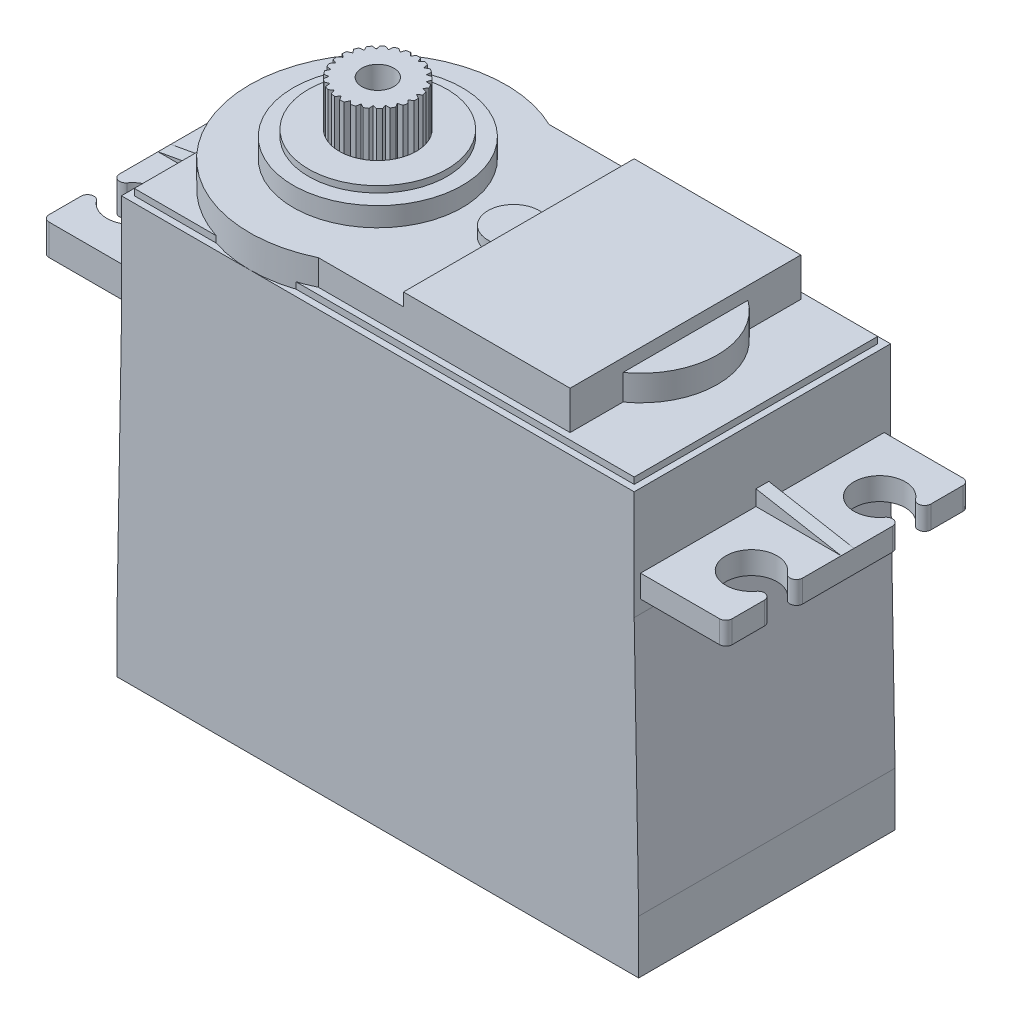
from build123d import *

# Parameters (mm, degrees)
BODY_1_DEPTH                                     = 10
SKETCH2_W                                        = 39
SKETCH2_H                                        = 19
BOSS_EXTRUDE3_DEPTH                              = 0.5
BOSS_EXTRUDE5_DEPTH                              = 0.5
BOSS_EXTRUDE6_START                              = 2
BOSS_EXTRUDE6_DEPTH                              = 2
SKETCH11_W                                       = 13
SKETCH11_H                                       = 18
BOSS_EXTRUDE7_DEPTH                              = 1
BOSS_EXTRUDE8_DEPTH                              = 0.8
SKETCH13_R                                       = 6.6
BOSS_EXTRUDE9_DEPTH                              = 1.5
SKETCH14_R                                       = 5.4
BOSS_EXTRUDE10_DEPTH                             = 0.5
SKETCH17_R                                       = 3
CUT_EXTRUDE1_DEPTH                               = 12
CHAMFER2_SIZE                                    = 2.82
CBORE_FOR_M2_PAN_HEAD_MACHINE_SCREW1_D           = 2.4
CBORE_FOR_M2_PAN_HEAD_MACHINE_SCREW1_DEPTH       = 8
CBORE_FOR_M2_PAN_HEAD_MACHINE_SCREW1_CBORE_D     = 5
CBORE_FOR_M2_PAN_HEAD_MACHINE_SCREW1_CBORE_DEPTH = 1.6
CBORE_FOR_M2_PAN_HEAD_MACHINE_SCREW1_TIP         = 0.721032743
SKETCH21_R                                       = 3
BOSS_EXTRUDE11_DEPTH                             = 10.5
BOSS_EXTRUDE16_DEPTH                             = 5
SKETCH23_W                                       = 19
SKETCH23_H                                       = 1.753963838
BOSS_EXTRUDE17_DEPTH                             = 6.65
FILLET1_R                                        = 0.5
CUT_EXTRUDE2_DEPTH                               = 7
SKETCH26_W                                       = 1
SKETCH26_H                                       = 1.2
BOSS_EXTRUDE18_DEPTH                             = 6.65
CUT_EXTRUDE3_DEPTH                               = 6.65
BOSS_EXTRUDE19_DEPTH                             = 6.65
CUT_EXTRUDE4_DEPTH                               = 6.65
CUT_EXTRUDE6_DEPTH                               = 6.65
FILLET2_R                                        = 0.5
SKETCH34_R                                       = 1.25
CUT_EXTRUDE7_DEPTH                               = 8


with BuildPart() as part:
    # Sketch1 → Body 1 (new, symmetric)
    with BuildSketch(Plane.XY):
        Polygon((0, 6.994041123), (0, 0), (40.698202597, 0), (40.698202597, 6.994041123), (40.349101299, 26.994041123), (40.349101299, 35.494041123), (0.349101299, 35.494041123), (0.349101299, 26.994041123), align=None)
    extrude(amount=BODY_1_DEPTH, both=True)

    # Sketch2 → Boss-Extrude3 (add)
    with BuildSketch(Plane(origin=(0, 35.494041123, 0), x_dir=(1, 0, 0), z_dir=(0, 1, 0))):
        with Locations((20.349101299, 0)):
            Rectangle(SKETCH2_W, SKETCH2_H)
    extrude(amount=BOSS_EXTRUDE3_DEPTH)

    # Sketch3 → Boss-Extrude5 (add)
    with BuildSketch(Plane(origin=(0, 35.994041123, 0), x_dir=(1, 0, 0), z_dir=(0, 1, 0))):
        with BuildLine():
            ThreePointArc((0.849101299, 3.122498999), (0.349101299, 0), (0.849101299, -3.122498999))
            Line((0.849101299, -3.122498999), (0.849101299, 3.122498999))
        make_face()
        with BuildLine():
            ThreePointArc((13.471600298, 9.5), (10.349101299, 10), (7.226602299, 9.5))
            Line((7.226602299, 9.5), (13.471600298, 9.5))
        make_face()
        with BuildLine():
            Line((13.471600298, -9.5), (7.226602299, -9.5))
            ThreePointArc((7.226602299, -9.5), (10.349101299, -10), (13.471600298, -9.5))
        make_face()
    extrude(amount=-BOSS_EXTRUDE5_DEPTH)

    # Sketch8 → Boss-Extrude6 (add)
    with BuildSketch(Plane(origin=(0, 35.994041123, 0), x_dir=(1, 0, 0), z_dir=(0, 1, 0)).offset(BOSS_EXTRUDE6_START)):
        with BuildLine():
            Line((14.708000242, -9), (34.349101299, -9))
            Line((34.349101299, -9), (34.349101299, -4.873397172))
            ThreePointArc((34.349101299, -4.873397172), (36.849101299, 0), (34.349101299, 4.873397172))
            Line((34.349101299, 4.873397172), (34.349101299, 9))
            Line((34.349101299, 9), (14.708000242, 9))
            ThreePointArc((14.708000242, 9), (5.038215753, 8.473163206), (0.349101299, 0))
            ThreePointArc((0.349101299, 0), (5.038215753, -8.473163206), (14.708000242, -9))
        make_face()
    extrude(amount=-BOSS_EXTRUDE6_DEPTH)

    # Sketch11 → Boss-Extrude7 (add)
    with BuildSketch(Plane(origin=(0, 37.994041123, 0), x_dir=(1, 0, 0), z_dir=(0, 1, 0))):
        with Locations((27.849101299, 0)):
            Rectangle(SKETCH11_W, SKETCH11_H)
    extrude(amount=BOSS_EXTRUDE7_DEPTH)

    # Sketch12 → Boss-Extrude8 (add)
    with BuildSketch(Plane(origin=(0, 37.994041123, 0), x_dir=(1, 0, 0), z_dir=(0, 1, 0))):
        with BuildLine():
            ThreePointArc((21.349101299, 1.959591794), (18.949101299, 0), (21.349101299, -1.959591794))
            Line((21.349101299, -1.959591794), (21.349101299, 0))
            Line((21.349101299, 0), (21.349101299, 1.959591794))
        make_face()
    extrude(amount=BOSS_EXTRUDE8_DEPTH)

    # Sketch13 → Boss-Extrude9 (add)
    with BuildSketch(Plane(origin=(0, 37.994041123, 0), x_dir=(1, 0, 0), z_dir=(0, 1, 0))):
        with Locations((10.349101299, 0)):
            Circle(SKETCH13_R)
    extrude(amount=BOSS_EXTRUDE9_DEPTH)

    # Sketch14 → Boss-Extrude10 (add)
    with BuildSketch(Plane(origin=(0, 39.494041123, 0), x_dir=(1, 0, 0), z_dir=(0, 1, 0))):
        with Locations((10.349101299, 0)):
            Circle(SKETCH14_R)
    extrude(amount=BOSS_EXTRUDE10_DEPTH)

    # Sketch17 → Cut-Extrude1 (cut)
    with BuildSketch(Plane(origin=(0, 39.994041123, 0), x_dir=(1, 0, 0), z_dir=(0, 1, 0))):
        with Locations((10.349101299, 0)):
            Circle(SKETCH17_R)
    extrude(amount=-CUT_EXTRUDE1_DEPTH, mode=Mode.SUBTRACT)

    # Chamfer2
    chamfer2_edges = [part.edges().sort_by_distance(p)[0] for p in [
        (20.349101299, 0, -10),
        (40.698202597, 0, 0),
        (20.349101299, 0, 10),
        (0, 0, 0),
    ]]
    chamfer(chamfer2_edges, length=CHAMFER2_SIZE)

    # CBORE for M2 Pan Head Machine Screw1
    with Locations(Plane(origin=(0, 0, 0), x_dir=(-1, 0, 0), z_dir=(0, -1, 0))):
        with Locations((-38.698202597, 8), (-2, 8), (-2, -8), (-38.698202597, -8)):
            CounterBoreHole(CBORE_FOR_M2_PAN_HEAD_MACHINE_SCREW1_D / 2, CBORE_FOR_M2_PAN_HEAD_MACHINE_SCREW1_CBORE_D / 2, CBORE_FOR_M2_PAN_HEAD_MACHINE_SCREW1_CBORE_DEPTH, depth=CBORE_FOR_M2_PAN_HEAD_MACHINE_SCREW1_DEPTH)
            with Locations((0, 0, -(CBORE_FOR_M2_PAN_HEAD_MACHINE_SCREW1_DEPTH + CBORE_FOR_M2_PAN_HEAD_MACHINE_SCREW1_TIP / 2))):  # 118° drill point
                Cone(0, CBORE_FOR_M2_PAN_HEAD_MACHINE_SCREW1_D / 2, CBORE_FOR_M2_PAN_HEAD_MACHINE_SCREW1_TIP, mode=Mode.SUBTRACT)

    # Sketch23 → Boss-Extrude17 (add)
    with BuildSketch(Plane(origin=(40.349101299, 0, 0), x_dir=(0, 0, -1), z_dir=(1, 0, 0))):
        with Locations((0, 28.871023042)):
            Rectangle(SKETCH23_W, SKETCH23_H)
    extrude(amount=BOSS_EXTRUDE17_DEPTH)

    # Fillet1
    fillet1_edges = [part.edges().sort_by_distance(p)[0] for p in [
        (46.999101299, 28.871023042, 9.5),
        (46.999101299, 28.871023042, -9.5),
    ]]
    fillet(fillet1_edges, radius=FILLET1_R)

    # Sketch25 → Cut-Extrude2 (cut)
    with BuildSketch(Plane(origin=(0, 29.748004961, 0), x_dir=(1, 0, 0), z_dir=(0, 1, 0))):
        with BuildLine():
            Line((46.999101299, 6.5), (46.999101299, 3.5))
            ThreePointArc((46.999101299, 3.5), (46.657215182, 3.974341649), (46.099101299, 3.8))
            ThreePointArc((46.099101299, 3.8), (42.499101299, 5), (46.099101299, 6.2))
            ThreePointArc((46.099101299, 6.2), (46.657215182, 6.025658351), (46.999101299, 6.5))
        make_face()
        with BuildLine():
            Line((46.999101299, -3.5), (46.999101299, -6.5))
            ThreePointArc((46.999101299, -6.5), (46.657215182, -6.025658351), (46.099101299, -6.2))
            ThreePointArc((46.099101299, -6.2), (42.499101299, -5), (46.099101299, -3.8))
            ThreePointArc((46.099101299, -3.8), (46.657215182, -3.974341649), (46.999101299, -3.5))
        make_face()
    extrude(amount=-CUT_EXTRUDE2_DEPTH, mode=Mode.SUBTRACT)

    # Sketch26 → Boss-Extrude18 (add)
    with BuildSketch(Plane(origin=(40.349101299, 0, 0), x_dir=(0, 0, -1), z_dir=(1, 0, 0))):
        with Locations((0, 30.348004961)):
            Rectangle(SKETCH26_W, SKETCH26_H)
    extrude(amount=BOSS_EXTRUDE18_DEPTH)

    # Sketch28 → Cut-Extrude3 (cut)
    with BuildSketch(Plane.XY.offset(0.5)):
        Polygon((40.349101299, 30.948004961), (46.999101299, 29.748004961), (46.999101299, 30.948004961), align=None)
    extrude(amount=-CUT_EXTRUDE3_DEPTH, mode=Mode.SUBTRACT)

    # Sketch29 → Boss-Extrude19 (add)
    with BuildSketch(Plane.ZY.offset(-0.349101299)):
        Polygon((-9.5, 30.394041123), (-0.5, 30.394041123), (-0.5, 31.594041123), (0.5, 31.594041123), (0.5, 30.394041123), (9.5, 30.394041123), (9.5, 27.994041123), (-9.5, 27.994041123), align=None)
    extrude(amount=BOSS_EXTRUDE19_DEPTH)

    # Sketch30 → Cut-Extrude4 (cut)
    with BuildSketch(Plane(origin=(0, 0, -0.5), x_dir=(-1, 0, 0), z_dir=(0, 0, -1))):
        Polygon((-0.349101299, 31.594041123), (6.300898701, 30.394041123), (6.300898701, 31.594041123), align=None)
    extrude(amount=-CUT_EXTRUDE4_DEPTH, mode=Mode.SUBTRACT)

    # Sketch31 → Cut-Extrude6 (cut)
    with BuildSketch(Plane.XZ.offset(-27.994041123)):
        with BuildLine():
            Line((-6.300898701, -6.5), (-6.300898701, -3.5))
            ThreePointArc((-6.300898701, -3.5), (-5.959012584, -3.974341649), (-5.400898701, -3.8))
            ThreePointArc((-5.400898701, -3.8), (-1.800898701, -5), (-5.400898701, -6.2))
            ThreePointArc((-5.400898701, -6.2), (-5.959012584, -6.025658351), (-6.300898701, -6.5))
        make_face()
        with BuildLine():
            Line((-6.300898701, 6.5), (-6.300898701, 3.5))
            ThreePointArc((-6.300898701, 3.5), (-5.959012584, 3.974341649), (-5.400898701, 3.8))
            ThreePointArc((-5.400898701, 3.8), (-1.800898701, 5), (-5.400898701, 6.2))
            ThreePointArc((-5.400898701, 6.2), (-5.959012584, 6.025658351), (-6.300898701, 6.5))
        make_face()
    extrude(amount=-CUT_EXTRUDE6_DEPTH, mode=Mode.SUBTRACT)

    # Fillet2
    fillet2_edges = [part.edges().sort_by_distance(p)[0] for p in [
        (-6.300898701, 29.194041123, -9.5),
        (-6.300898701, 29.194041123, 9.5),
    ]]
    fillet(fillet2_edges, radius=FILLET2_R)


with BuildPart() as body_2:
    # Sketch21 → Boss-Extrude11 (new body)
    with BuildSketch(Plane(origin=(0, 27.994041123, 0), x_dir=(1, 0, 0), z_dir=(0, 1, 0))):
        with Locations((10.349101299, 0)):
            Circle(SKETCH21_R)
    extrude(amount=BOSS_EXTRUDE11_DEPTH)

    # Sketch22 → Boss-Extrude16 (add)
    with BuildSketch(Plane(origin=(0, 38.494041123, 0), x_dir=(1, 0, 0), z_dir=(0, 1, 0))):
        with BuildLine():
            Line((7.35816942, 0.21203453), (7.649101299, 0))
            Line((7.649101299, 0), (7.35816942, -0.21203453))
            ThreePointArc((7.35816942, -0.21203453), (7.374306596, -0.375803966), (7.399404201, -0.538441436))
            Line((7.399404201, -0.538441436), (7.733926764, -0.671462695))
            Line((7.733926764, -0.671462695), (7.504865888, -0.949187587))
            ThreePointArc((7.504865888, -0.949187587), (7.561223887, -1.103798752), (7.6259793, -1.255085146))
            Line((7.6259793, -1.255085146), (7.983073262, -1.30073492))
            Line((7.983073262, -1.30073492), (7.830276128, -1.626699697))
            ThreePointArc((7.830276128, -1.626699697), (7.92331377, -1.762437803), (8.023658168, -1.892867241))
            Line((8.023658168, -1.892867241), (8.380886005, -1.848277186))
            Line((8.380886005, -1.848277186), (8.313953416, -2.202000282))
            ThreePointArc((8.313953416, -2.202000282), (8.437824804, -2.310336406), (8.567453181, -2.411713526))
            Line((8.567453181, -2.411713526), (8.902368952, -2.279685399))
            Line((8.902368952, -2.279685399), (8.925506531, -2.638941091))
            ThreePointArc((8.925506531, -2.638941091), (9.07242837, -2.713068075), (9.223195697, -2.77902298))
            Line((9.223195697, -2.77902298), (9.514755414, -2.567852594))
            Line((9.514755414, -2.567852594), (9.626509341, -2.910067526))
            ThreePointArc((9.626509341, -2.910067526), (9.787249991, -2.945327699), (9.949683004, -2.9717162))
            Line((9.949683004, -2.9717162), (10.179566896, -2.694672167))
            Line((10.179566896, -2.694672167), (10.37291526, -2.998343716))
            ThreePointArc((10.37291526, -2.998343716), (10.537374796, -2.992521551), (10.70126723, -2.977685561))
            Line((10.70126723, -2.977685561), (10.855030848, -2.652175577))
            Line((10.855030848, -2.652175577), (11.117824861, -2.898222943))
            ThreePointArc((11.117824861, -2.898222943), (11.275669685, -2.851684269), (11.430723576, -2.796555988))
            Line((11.430723576, -2.796555988), (11.498705386, -2.443033042))
            Line((11.498705386, -2.443033042), (11.814432734, -2.615996164))
            ThreePointArc((11.814432734, -2.615996164), (11.955744874, -2.531665176), (12.092217616, -2.439708517))
            Line((12.092217616, -2.439708517), (12.070146071, -2.080385755))
            Line((12.070146071, -2.080385755), (12.418968443, -2.169396725))
            ThreePointArc((12.418968443, -2.169396725), (12.534868739, -2.05257225), (12.644185248, -1.929565187))
            Line((12.644185248, -1.929565187), (12.533447183, -1.587020181))
            Line((12.533447183, -1.587020181), (12.893446787, -1.586486111))
            ThreePointArc((12.893446787, -1.586486111), (12.976652797, -1.44450866), (13.051944314, -1.29818018))
            Line((13.051944314, -1.29818018), (12.85949781, -0.993936292))
            Line((12.85949781, -0.993936292), (13.208054547, -0.90389074))
            ThreePointArc((13.208054547, -0.90389074), (13.25333813, -0.745681279), (13.289873813, -0.585225738))
            Line((13.289873813, -0.585225738), (13.027810992, -0.338399731))
            Line((13.027810992, -0.338399731), (13.343023759, -0.164500589))
            ThreePointArc((13.343023759, -0.164500589), (13.346410414, -0.082281281), (13.347539583, 0))
            ThreePointArc((13.347539583, 0), (13.346410414, 0.082281281), (13.343023759, 0.164500589))
            Line((13.343023759, 0.164500589), (13.027810992, 0.338399731))
            Line((13.027810992, 0.338399731), (13.289873813, 0.585225738))
            ThreePointArc((13.289873813, 0.585225738), (13.25333813, 0.745681279), (13.208054547, 0.90389074))
            Line((13.208054547, 0.90389074), (12.85949781, 0.993936292))
            Line((12.85949781, 0.993936292), (13.051944314, 1.29818018))
            ThreePointArc((13.051944314, 1.29818018), (12.976652797, 1.44450866), (12.893446787, 1.586486111))
            Line((12.893446787, 1.586486111), (12.533447183, 1.587020181))
            Line((12.533447183, 1.587020181), (12.644185248, 1.929565187))
            ThreePointArc((12.644185248, 1.929565187), (12.534868739, 2.05257225), (12.418968443, 2.169396725))
            Line((12.418968443, 2.169396725), (12.070146071, 2.080385755))
            Line((12.070146071, 2.080385755), (12.092217616, 2.439708517))
            ThreePointArc((12.092217616, 2.439708517), (11.955744874, 2.531665176), (11.814432734, 2.615996164))
            Line((11.814432734, 2.615996164), (11.498705386, 2.443033042))
            Line((11.498705386, 2.443033042), (11.430723576, 2.796555988))
            ThreePointArc((11.430723576, 2.796555988), (11.275669685, 2.851684269), (11.117824861, 2.898222943))
            Line((11.117824861, 2.898222943), (10.855030848, 2.652175577))
            Line((10.855030848, 2.652175577), (10.70126723, 2.977685561))
            ThreePointArc((10.70126723, 2.977685561), (10.537374796, 2.992521551), (10.37291526, 2.998343716))
            Line((10.37291526, 2.998343716), (10.179566896, 2.694672167))
            Line((10.179566896, 2.694672167), (9.949683004, 2.9717162))
            ThreePointArc((9.949683004, 2.9717162), (9.787249991, 2.945327699), (9.626509341, 2.910067526))
            Line((9.626509341, 2.910067526), (9.514755414, 2.567852594))
            Line((9.514755414, 2.567852594), (9.223195697, 2.77902298))
            ThreePointArc((9.223195697, 2.77902298), (9.07242837, 2.713068075), (8.925506531, 2.638941091))
            Line((8.925506531, 2.638941091), (8.902368952, 2.279685399))
            Line((8.902368952, 2.279685399), (8.567453181, 2.411713526))
            ThreePointArc((8.567453181, 2.411713526), (8.437824804, 2.310336406), (8.313953416, 2.202000282))
            Line((8.313953416, 2.202000282), (8.380886005, 1.848277186))
            Line((8.380886005, 1.848277186), (8.023658168, 1.892867241))
            ThreePointArc((8.023658168, 1.892867241), (7.92331377, 1.762437803), (7.830276128, 1.626699697))
            Line((7.830276128, 1.626699697), (7.983073262, 1.30073492))
            Line((7.983073262, 1.30073492), (7.6259793, 1.255085146))
            ThreePointArc((7.6259793, 1.255085146), (7.561223887, 1.103798752), (7.504865888, 0.949187587))
            Line((7.504865888, 0.949187587), (7.733926764, 0.671462695))
            Line((7.733926764, 0.671462695), (7.399404201, 0.538441436))
            ThreePointArc((7.399404201, 0.538441436), (7.374306596, 0.375803966), (7.35816942, 0.21203453))
        make_face()
    extrude(amount=BOSS_EXTRUDE16_DEPTH)

    # Sketch34 → Cut-Extrude7 (cut)
    with BuildSketch(Plane(origin=(0, 43.494041123, 0), x_dir=(1, 0, 0), z_dir=(0, 1, 0))):
        with Locations((10.349101299, 0)):
            Circle(SKETCH34_R)
    extrude(amount=-CUT_EXTRUDE7_DEPTH, mode=Mode.SUBTRACT)


solid = Compound([part.part, body_2.part])
